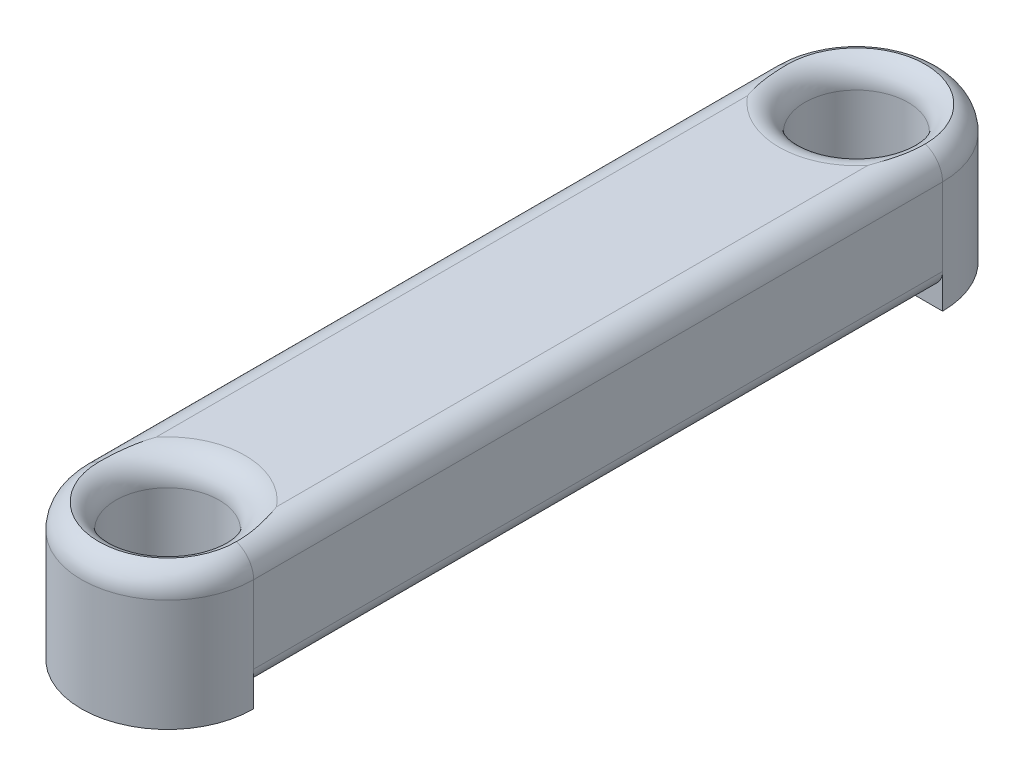
from build123d import *

# Parameters (mm, degrees)
SKETCH1_R           = 1.5
BOSS_EXTRUDE1_DEPTH = 4
SKETCH2_W           = 20
SKETCH2_H           = 0.5
CUT_EXTRUDE1_DEPTH  = 15.044571905
FILLET1_R           = 0.5
FILLET2_R           = 0.75


with BuildPart() as part:
    # Sketch1 → Boss-Extrude1 (new body)
    with BuildSketch(Plane(origin=(0, 0, 0), x_dir=(1, 0, 0), z_dir=(0, 1, 0))):
        with BuildLine():
            Line((-2.5, -10), (-2.5, 10))
            ThreePointArc((-2.5, 10), (0, 12.5), (2.5, 10))
            Line((2.5, 10), (2.5, -10))
            ThreePointArc((2.5, -10), (0, -12.5), (-2.5, -10))
        make_face()
        with Locations(Location((0, -10, 0), (0, 0, 270))):
            Circle(SKETCH1_R, mode=Mode.SUBTRACT)
        with Locations(Location((0, 10, 0), (0, 0, 270))):
            Circle(SKETCH1_R, mode=Mode.SUBTRACT)
    extrude(amount=BOSS_EXTRUDE1_DEPTH)

    # Sketch2 → Cut-Extrude1 (cut, through all)
    with BuildSketch(Plane(origin=(2.5, 0, 0), x_dir=(0, 0, -1), z_dir=(1, 0, 0))):
        with Locations((0, 0.25)):
            Rectangle(SKETCH2_W, SKETCH2_H)
    extrude(amount=-CUT_EXTRUDE1_DEPTH, mode=Mode.SUBTRACT)

    # Fillet1
    fillet1_edges = [part.edges().sort_by_distance(p)[0] for p in [
        (2.5, 0.5, 0),
        (-2.5, 0.5, 0),
    ]]
    fillet(fillet1_edges, radius=FILLET1_R)

    # Fillet2
    # the kernel refuses this fillet: 0.75 mm, written as the material it takes off along each edge
    with BuildSketch(Plane(origin=(0, 4, 10), x_dir=(0, 0, 1), z_dir=(-1, 0, 0))) as fillet2_piece_1:
        with BuildLine():
            CenterArc((1.5 + FILLET2_R, -FILLET2_R), FILLET2_R, 90, 90)
            Line((1.5 + FILLET2_R, 0), (1.5, 0))
            Line((1.5, 0), (1.5, -FILLET2_R))
        make_face()
    revolve(axis=Axis((0, 4, 10), (0, 1, 0)), mode=Mode.SUBTRACT)
    with BuildSketch(Plane(origin=(0, 4, -10), x_dir=(-1, 0, 0), z_dir=(0, 0, 1))) as fillet2_piece_2:
        with BuildLine():
            CenterArc((2.5 - FILLET2_R, FILLET2_R), FILLET2_R, 270, 90)
            Line((2.5 - FILLET2_R, 0), (2.5, 0))
            Line((2.5, 0), (2.5, FILLET2_R))
        make_face()
    revolve(axis=Axis((0, 4, -10), (0, -1, 0)), revolution_arc=180, mode=Mode.SUBTRACT)
    with BuildSketch(Plane(origin=(0, 4, -10), x_dir=(0, 0, 1), z_dir=(-1, 0, 0))) as fillet2_piece_3:
        with BuildLine():
            CenterArc((1.5 + FILLET2_R, -FILLET2_R), FILLET2_R, 90, 90)
            Line((1.5 + FILLET2_R, 0), (1.5, 0))
            Line((1.5, 0), (1.5, -FILLET2_R))
        make_face()
    revolve(axis=Axis((0, 4, -10), (0, 1, 0)), mode=Mode.SUBTRACT)
    with BuildSketch(Plane(origin=(-2.5, 4, 10), x_dir=(1, 0, 0), z_dir=(0, 0, -1))) as fillet2_piece_4:
        with BuildLine():
            CenterArc((FILLET2_R, FILLET2_R), FILLET2_R, 180, 90)
            Line((0, FILLET2_R), (0, 0))
            Line((0, 0), (FILLET2_R, 0))
        make_face()
    extrude(amount=20, mode=Mode.SUBTRACT)
    with BuildSketch(Plane(origin=(0, 4, 10), x_dir=(1, 0, 0), z_dir=(0, 0, -1))) as fillet2_piece_5:
        with BuildLine():
            CenterArc((2.5 - FILLET2_R, FILLET2_R), FILLET2_R, 270, 90)
            Line((2.5 - FILLET2_R, 0), (2.5, 0))
            Line((2.5, 0), (2.5, FILLET2_R))
        make_face()
    revolve(axis=Axis((0, 4, 10), (0, -1, 0)), revolution_arc=180, mode=Mode.SUBTRACT)
    with BuildSketch(Plane(origin=(2.5, 4, -10), x_dir=(0, -1, 0), z_dir=(0, 0, 1))) as fillet2_piece_6:
        with BuildLine():
            CenterArc((FILLET2_R, -FILLET2_R), FILLET2_R, 90, 90)
            Line((0, -FILLET2_R), (0, 0))
            Line((0, 0), (FILLET2_R, 0))
        make_face()
    extrude(amount=20, mode=Mode.SUBTRACT)


solid = part.part
